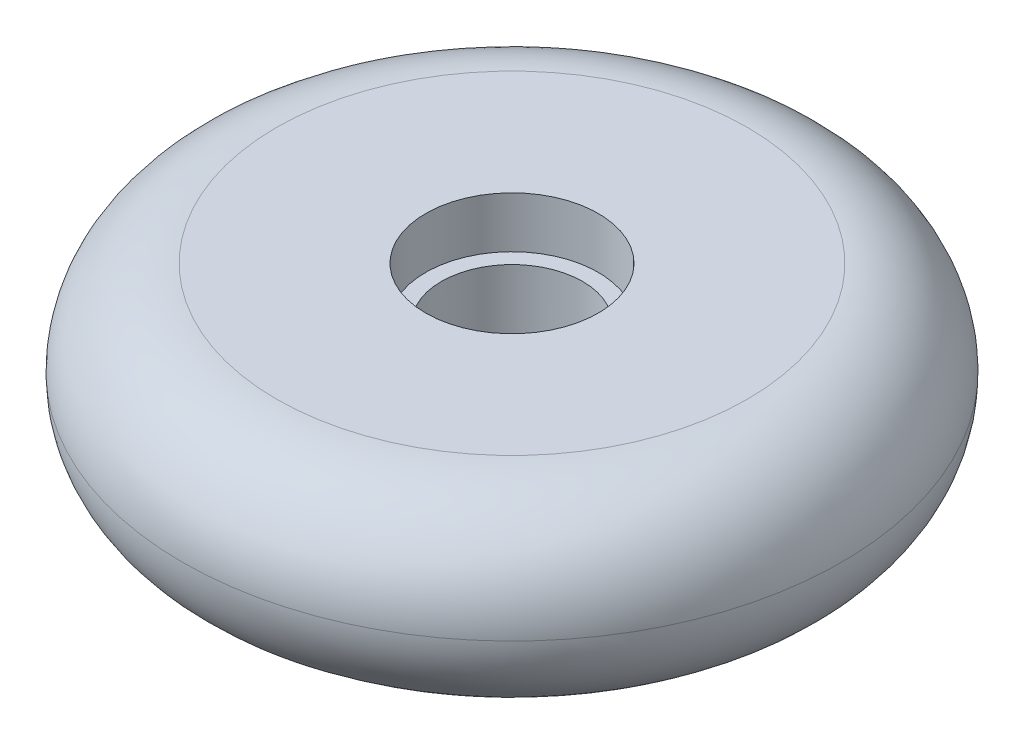
from build123d import *

# Parameters (mm, degrees)
SKETCH1_R           = 42
BOSS_EXTRUDE1_DEPTH = 24
FILLET1_R           = 12
SKETCH2_R           = 11
CUT_EXTRUDE1_DEPTH  = 6.5
CUT_EXTRUDE2_START  = -6.5
SKETCH3_R           = 11
CUT_EXTRUDE2_DEPTH  = 6.5
SKETCH4_R           = 9
CUT_EXTRUDE3_DEPTH  = 62.921321113


with BuildPart() as part:
    # Sketch1 → Boss-Extrude1 (new body)
    with BuildSketch(Plane(origin=(0, 0, 0), x_dir=(1, 0, 0), z_dir=(0, 1, 0))):
        with Locations(Location((0, 0, 0), (0, 0, 270))):
            Circle(SKETCH1_R)
    extrude(amount=BOSS_EXTRUDE1_DEPTH)

    # Fillet1
    fillet1_edges = [part.edges().sort_by_distance(p)[0] for p in [
        (0, 0, -42),
        (0, 24, -42),
    ]]
    fillet(fillet1_edges, radius=FILLET1_R - 0.0001)  # a hair under: the kernel refuses the full size

    # Sketch2 → Cut-Extrude1 (cut)
    with BuildSketch(Plane(origin=(0, 24, 0), x_dir=(1, 0, 0), z_dir=(0, 1, 0))):
        with Locations(Location((0, 0, 0), (0, 0, 270))):
            Circle(SKETCH2_R)
    extrude(amount=-CUT_EXTRUDE1_DEPTH, mode=Mode.SUBTRACT)

    # Sketch3 → Cut-Extrude2 (cut)
    with BuildSketch(Plane.XZ.offset(CUT_EXTRUDE2_START)):
        with Locations(Location((0, 0, 0), (0, 0, 90))):
            Circle(SKETCH3_R)
    extrude(amount=CUT_EXTRUDE2_DEPTH, mode=Mode.SUBTRACT)

    # Sketch4 → Cut-Extrude3 (cut, through all)
    with BuildSketch(Plane.XZ.offset(-6.5)):
        with Locations(Location((0, 0, 0), (0, 0, 270))):
            Circle(SKETCH4_R)
    extrude(amount=-CUT_EXTRUDE3_DEPTH, mode=Mode.SUBTRACT)


solid = part.part
